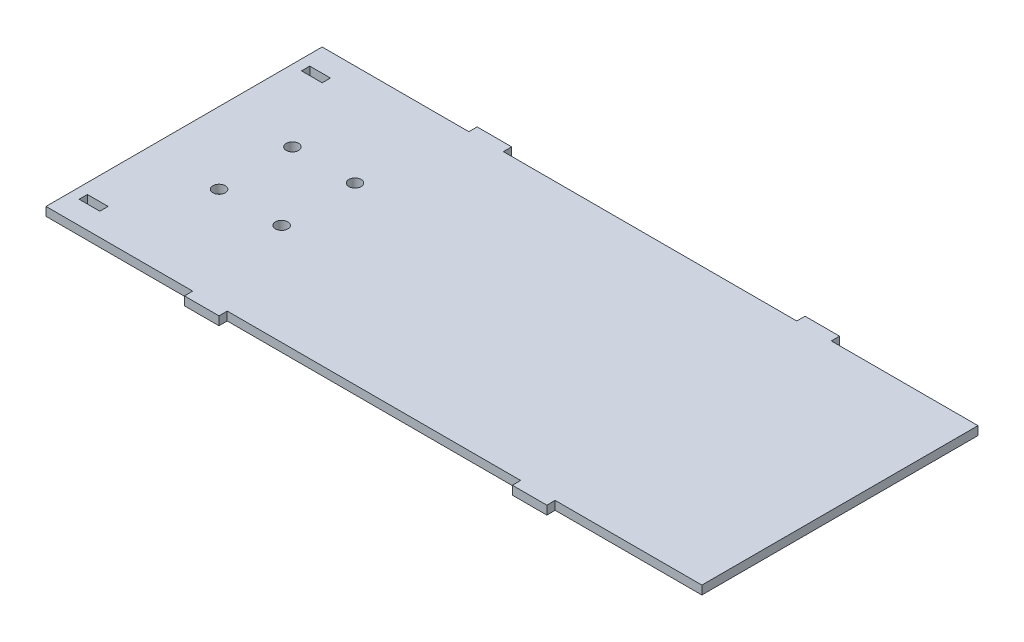
from build123d import *

# Parameters (mm, degrees)
MAIN_FRAME_DEPTH   = 3.175
SKETCH2_R          = 2.276969522
FRONT_WHEEL_DEPTH  = 252.434374199
SKETCH4_W          = 7.62
SKETCH4_H          = 3.048
SENSOR_HOLES_DEPTH = 252.434374199


with BuildPart() as part:
    # Sketch1 → Main Frame (new body)
    with BuildSketch(Plane(origin=(0, 0, 0), x_dir=(1, 0, 0), z_dir=(0, 1, 0))):
        Polygon((0, 0), (41.275, 0), (41.275, -3.048), (53.975, -3.048), (53.975, 0), (161.925, 0), (161.925, -3.048), (174.625, -3.048), (174.625, 0), (228.6, 0), (228.6, 101.6), (174.625, 101.6), (174.625, 104.648), (161.925, 104.648), (161.925, 101.6), (53.975, 101.6), (53.975, 104.648), (41.275, 104.648), (41.275, 101.6), (0, 101.6), (-12.7, 101.6), (-12.7, 0), align=None)
    extrude(amount=MAIN_FRAME_DEPTH)

    # Sketch2 → Front Wheel (cut, through all)
    with BuildSketch(Plane(origin=(0, 3.175, 0), x_dir=(1, 0, 0), z_dir=(0, 1, 0))):
        with Locations((13.674306915, 64.29375)):
            Circle(SKETCH2_R)
        with Locations((36.693056915, 64.29375)):
            Circle(SKETCH2_R)
        with Locations((36.693056915, 37.30625)):
            Circle(SKETCH2_R)
        with Locations((13.674306915, 37.30625)):
            Circle(SKETCH2_R)
    extrude(amount=-FRONT_WHEEL_DEPTH, mode=Mode.SUBTRACT)

    # Sketch4 → Sensor Holes (cut, through all)
    with BuildSketch(Plane(origin=(0, 3.175, 0), x_dir=(1, 0, 0), z_dir=(0, 1, 0))):
        with Locations((-5.08, 91.707882035)):
            Rectangle(SKETCH4_W, SKETCH4_H)
        with Locations((-5.08, 9.892117965)):
            Rectangle(SKETCH4_W, SKETCH4_H)
    extrude(amount=-SENSOR_HOLES_DEPTH, mode=Mode.SUBTRACT)


solid = part.part
